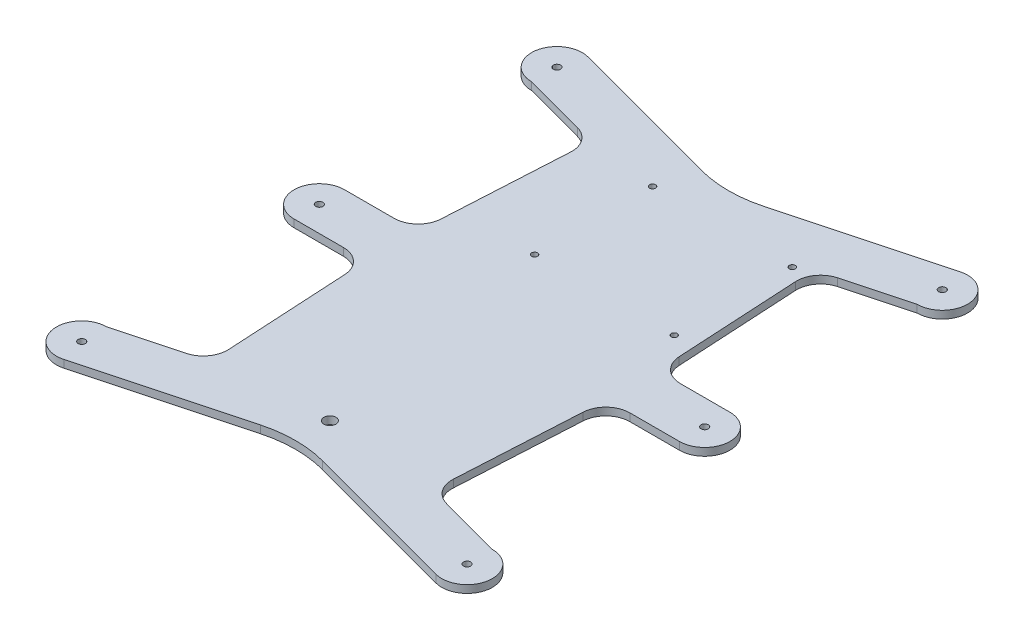
from build123d import *

# Parameters (mm, degrees)
SKETCH1_R               = 1.5
BOSS_EXTRUDE1_DEPTH     = 3.175
FILLET1_R               = 50
FILLET2_R               = 10
CUT_EXTRUDE1_DEPTH      = 142.82756039
CUT_EXTRUDE1_DEPTH_BACK = 142.82756039
SKETCH2_R               = 1.25
SKETCH2_R_2             = 2.5


with BuildPart() as part:
    # Sketch1 → Boss-Extrude1 (new body)
    with BuildSketch(Plane(origin=(0, 0, 0), x_dir=(1, 0, 0), z_dir=(0, 1, 0))):
        with BuildLine():
            Line((-80, 10.5), (-50, 10.5))
            Line((-50, 10.5), (-46.19259608, 79.095931406))
            Line((-46.19259608, 79.095931406), (-80, 88.154597985))
            ThreePointArc((-80, 88.154597985), (-90.410171044, 100.025123003), (-77.282400026, 108.796819161))
            Line((-77.282400026, 108.796819161), (0, 88.089062485))
            Line((0, 88.089062485), (77.282400026, 108.796819161))
            ThreePointArc((77.282400026, 108.796819161), (90.410171044, 100.025123003), (80, 88.154597985))
            Line((80, 88.154597985), (46.19259608, 79.095931406))
            Line((46.19259608, 79.095931406), (50, 10.5))
            Line((50, 10.5), (80, 10.5))
            ThreePointArc((80, 10.5), (90.5, 0), (80, -10.5))
            Line((80, -10.5), (50, -10.5))
            Line((50, -10.5), (46.19259608, -79.095931406))
            Line((46.19259608, -79.095931406), (80, -88.154597985))
            ThreePointArc((80, -88.154597985), (90.410171044, -100.025123003), (77.282400026, -108.796819161))
            Line((77.282400026, -108.796819161), (0, -88.089062485))
            Line((0, -88.089062485), (-77.282400026, -108.796819161))
            ThreePointArc((-77.282400026, -108.796819161), (-90.410171044, -100.025123003), (-80, -88.154597985))
            Line((-80, -88.154597985), (-46.19259608, -79.095931406))
            Line((-46.19259608, -79.095931406), (-50, -10.5))
            Line((-50, -10.5), (-80, -10.5))
            ThreePointArc((-80, -10.5), (-90.5, 0), (-80, 10.5))
        make_face()
        with Locations((-80, 98.654597985)):
            Circle(SKETCH1_R, mode=Mode.SUBTRACT)
        with Locations((-80, 0)):
            Circle(SKETCH1_R, mode=Mode.SUBTRACT)
        with Locations((80, 0)):
            Circle(SKETCH1_R, mode=Mode.SUBTRACT)
        with Locations((80, 98.654597985)):
            Circle(SKETCH1_R, mode=Mode.SUBTRACT)
        with Locations((80, -98.654597985)):
            Circle(SKETCH1_R, mode=Mode.SUBTRACT)
        with Locations((-80, -98.654597985)):
            Circle(SKETCH1_R, mode=Mode.SUBTRACT)
    extrude(amount=BOSS_EXTRUDE1_DEPTH)

    # Fillet1
    fillet1_edges = [part.edges().sort_by_distance(p)[0] for p in [
        (0, 1.5875, -88.089062485),
        (0, 1.5875, 88.089062485),
    ]]
    fillet(fillet1_edges, radius=FILLET1_R)

    # Fillet2
    fillet2_edges = [part.edges().sort_by_distance(p)[0] for p in [
        (46.19259608, 1.5875, 79.095931406),
        (50, 1.5875, 10.5),
        (50, 1.5875, -10.5),
        (46.19259608, 1.5875, -79.095931406),
        (-46.19259608, 1.5875, -79.095931406),
        (-50, 1.5875, -10.5),
        (-50, 1.5875, 10.5),
        (-46.19259608, 1.5875, 79.095931406),
    ]]
    fillet(fillet2_edges, radius=FILLET2_R)

    # Sketch2 → Cut-Extrude1 (cut, two sides: drawn at the far end of the back side and taken through both)
    with BuildSketch(Plane(origin=(0, 3.175, 0), x_dir=(1, 0, 0), z_dir=(0, 1, 0)).offset(-CUT_EXTRUDE1_DEPTH_BACK)):
        with Locations((-17.25, 75.618974869)):
            Circle(SKETCH2_R)
        with Locations((40.75, 75.618974869)):
            Circle(SKETCH2_R)
        with Locations((40.75, 26.618974869)):
            Circle(SKETCH2_R)
        with Locations((-17.25, 26.618974869)):
            Circle(SKETCH2_R)
        with Locations((0, -75.602871505)):
            Circle(SKETCH2_R_2)
    extrude(amount=CUT_EXTRUDE1_DEPTH + CUT_EXTRUDE1_DEPTH_BACK, mode=Mode.SUBTRACT)


solid = part.part
